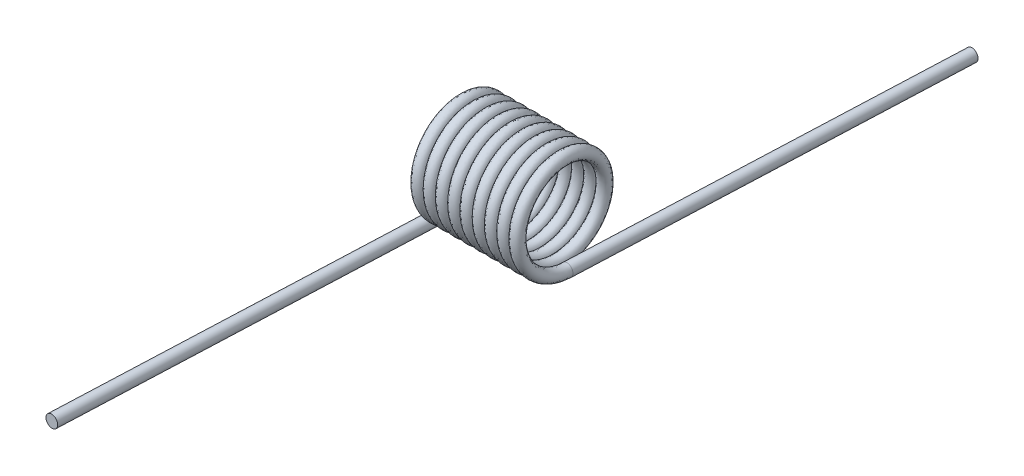
from build123d import *

# Parameters (mm, degrees)
SWEEP1_PITCH   = 3.2004
SKETCH4_R      = 1.5875
EXTRUDE1_DEPTH = 101.6
SKETCH5_R      = 1.5875
EXTRUDE2_DEPTH = 101.6


with BuildPart() as part:
    # Sweep1: the profile of Sketch3 screwed along a right-hand helix of 9 turns, 6 arcs to a turn; built about Z, then put on its axis
    sweep1_z = Axis((0, 0, 0), (0, 0, 1))
    sweep1_corners = [(12.190787355, -0.066454461, 1.585679469), (13.740971382, 0.001544561, -0.036855004), (12.117012645, 0.066454461, -1.585679469), (10.566828618, -0.001544561, 0.036855004)]
    with BuildLine(mode=Mode.PRIVATE) as sweep1_profile:
        ThreePointArc((12.190787355, -0.066454461, 1.585679469), (13.302212236, -0.04589823, 1.095184282), (13.740971382, 0.001544561, -0.036855004))
        ThreePointArc((13.740971382, 0.001544561, -0.036855004), (13.250045638, 0.04808257, -1.147305128), (12.117012645, 0.066454461, -1.585679469))
        ThreePointArc((12.117012645, 0.066454461, -1.585679469), (11.005587764, 0.04589823, -1.095184282), (10.566828618, -0.001544561, 0.036855004))
        ThreePointArc((10.566828618, -0.001544561, 0.036855004), (11.057754362, -0.04808257, 1.147305128), (12.190787355, -0.066454461, 1.585679469))
    sweep1_cap = Face(sweep1_profile.wire())
    sweep1_arcs = [((12.190787355, -0.066454461, 1.585679469), (13.777858737, -0.064909899, 1.548824465), (13.740971382, 0.001544561, -0.036855004), (1, 0.7071067811865476, 1)), ((13.740971382, 0.001544561, -0.036855004), (13.704084028, 0.067999022, -1.622534472), (12.117012645, 0.066454461, -1.585679469), (1, 0.7071067811865476, 1)), ((12.117012645, 0.066454461, -1.585679469), (10.529941263, 0.064909899, -1.548824465), (10.566828618, -0.001544561, 0.036855004), (1, 0.7071067811865476, 1)), ((10.566828618, -0.001544561, 0.036855004), (10.603715972, -0.067999022, 1.622534472), (12.190787355, -0.066454461, 1.585679469), (1, 0.7071067811865476, 1))]  # start, shoulder, end, weights
    sweep1_turn_angles = [0, 30, 60, 90, 120, 150, 180, 210, 240, 270, 300, 330, 360]
    sweep1_turn_weights = [1, 0.8660254037844387, 1, 0.8660254037844387, 1, 0.8660254037844387, 1, 0.8660254037844387, 1, 0.8660254037844387, 1, 0.8660254037844387, 1]
    sweep1_turn_sides = [Face.make_bezier_surface([[Vector(p[j][0], p[j][1], 0).rotate(sweep1_z, sweep1_turn_angles[2 * i + k]) / sweep1_turn_weights[2 * i + k] + Vector(0, 0, p[j][2] + SWEEP1_PITCH * sweep1_turn_angles[2 * i + k] / 360) for k in range(3)] for j in range(3)], [[p[3][j] * sweep1_turn_weights[2 * i + k] for k in range(3)] for j in range(3)]) for p in sweep1_arcs for i in range(6)]
    sweep1 = Plane(origin=(0, 0, 0), x_dir=(0, -1, 0), z_dir=(1, 0, 0)) * Solid(Shell([*[p.moved(Location((0, 0, SWEEP1_PITCH * i))) for i in range(9) for p in sweep1_turn_sides], sweep1_cap, sweep1_cap.rotate(sweep1_z, 3240).moved(Location((0, 0, SWEEP1_PITCH * 3240 / 360)))]))
    add(sweep1)

    # Sketch4 → Extrude1 (add)
    with BuildSketch(Plane(origin=(0, 0, 0), x_dir=(-0.9988532086790053, 0.023236129092748668, -0.04186107758336954), z_dir=(-0.04187238292980725, -9.868082913311314e-15, 0.9991229671806068))):
        with Locations(Location((-0.282409589, 12.150618504, 0), (0, 0, 181.33145196))):
            Circle(SKETCH4_R)
    extrude(amount=EXTRUDE1_DEPTH)

    # Sketch5 → Extrude2 (add)
    with BuildSketch(Plane(origin=(0.05050125, 0, -1.205017601), x_dir=(-0.998246136763925, -0.04188591672158325, -0.041835635722333855), z_dir=(0.04187238292980725, 1.2838905286138846e-13, -0.9991229671806067))):
        with Locations(Location((-28.244005182, -13.348640817, 0), (0, 0, 2.400588543))):
            Circle(SKETCH5_R)
    extrude(amount=EXTRUDE2_DEPTH)


solid = part.part
